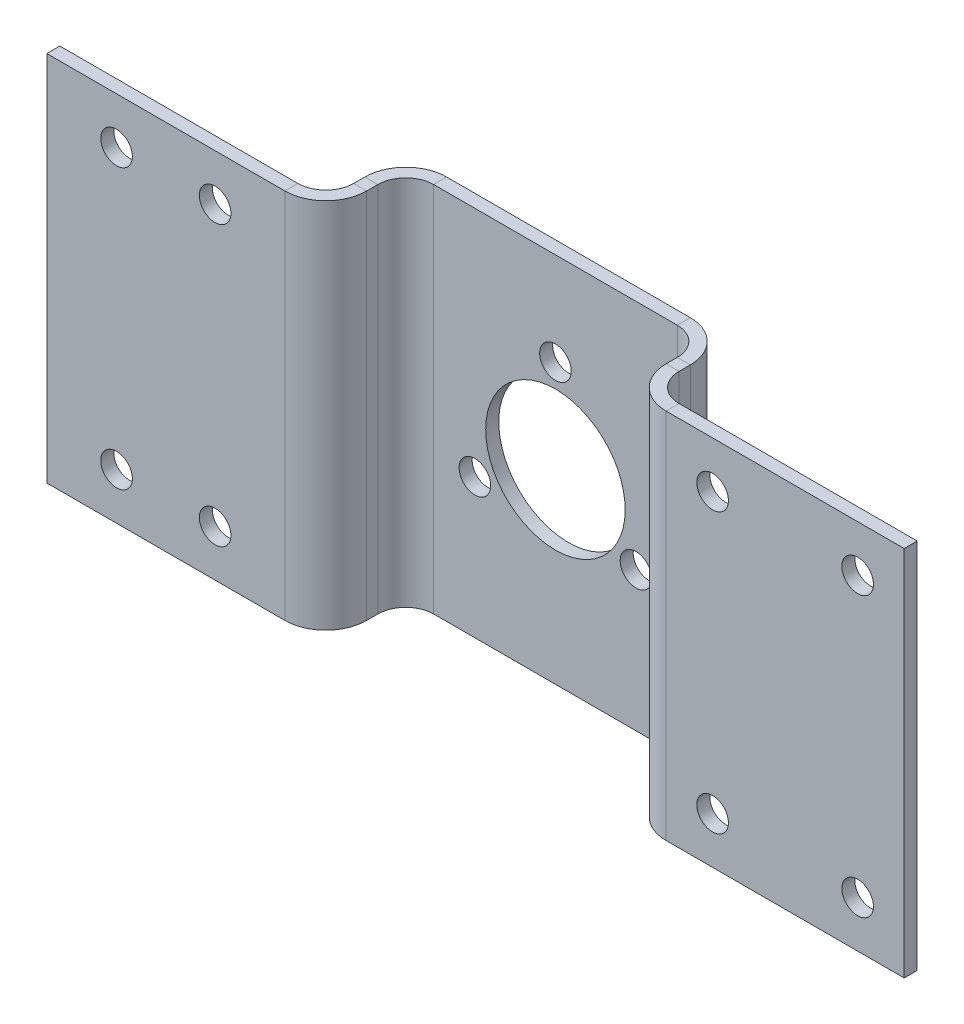
from build123d import *

# Parameters (mm, degrees)
SKETCH6_W                    = 35
SKETCH6_H                    = 40
BASE_FLANGE2_DEPTH           = 1.4
EDGE_FLANGE1_STRIP_W         = 11.6
EDGE_FLANGE1_STRIP_H         = 1.4
EDGE_FLANGE1_STRIP_CUT_DEPTH = 40
EDGE_FLANGE1_DEPTH           = 40
EDGE_FLANGE2_STRIP_W         = 11.6
EDGE_FLANGE2_STRIP_H         = 1.4
EDGE_FLANGE2_STRIP_CUT_DEPTH = 40
EDGE_FLANGE2_DEPTH           = 40
EDGE_FLANGE3_STRIP_W         = 11.6
EDGE_FLANGE3_STRIP_H         = 1.4
EDGE_FLANGE3_STRIP_CUT_DEPTH = 40
EDGE_FLANGE3_DEPTH           = 40
EDGE_FLANGE4_STRIP_W         = 11.6
EDGE_FLANGE4_STRIP_H         = 1.4
EDGE_FLANGE4_STRIP_CUT_DEPTH = 40
EDGE_FLANGE4_DEPTH           = 40
CUT_EXTRUDE2_DEPTH           = 76.623541308
CUT_EXTRUDE2_DEPTH_BACK      = 76.623541308
SKETCH11_R                   = 7.5
SKETCH11_R_2                 = 1.7
CUT_EXTRUDE3_DEPTH           = 76.795514379
CUT_EXTRUDE3_DEPTH_BACK      = 76.795514379
SKETCH26_R                   = 1.7
CUT_EXTRUDE4_DEPTH           = 76.795514379
CUT_EXTRUDE4_DEPTH_BACK      = 76.795514379
SKETCH27_R                   = 1.7


# Sheet-metal steps are written as plain solids
with BuildPart() as part:
    # Sketch6 → Base-Flange2 (new body)
    with BuildSketch(Plane.XY):
        with Locations((17.5, 20)):
            Rectangle(SKETCH6_W, SKETCH6_H)
    extrude(amount=-BASE_FLANGE2_DEPTH)

    # Edge-Flange1 strip (across the edge) → Edge-Flange1 strip cut (cut)
    with BuildSketch(Plane.XZ.offset(-40)):
        with Locations((-1.4, -0.7)):
            Rectangle(EDGE_FLANGE1_STRIP_W, EDGE_FLANGE1_STRIP_H)
    extrude(amount=EDGE_FLANGE1_STRIP_CUT_DEPTH, mode=Mode.SUBTRACT)

    # Edge-Flange1 section (across the edge) → Edge-Flange1 (add)
    with BuildSketch(Plane.XZ.offset(-40)):
        with BuildLine():
            Line((0, 3), (0, 8.6))
            Line((0, 8.6), (1.4, 8.6))
            Line((1.4, 8.6), (1.4, 3))
            ThreePointArc((1.4, 3), (2.278679656, 0.878679656), (4.4, 0))
            Line((4.4, 0), (4.4, -1.4))
            ThreePointArc((4.4, -1.4), (1.288730163, -0.111269837), (0, 3))
        make_face()
    extrude(amount=EDGE_FLANGE1_DEPTH)

    # Edge-Flange2 strip (across the edge) → Edge-Flange2 strip cut (cut)
    with BuildSketch(Plane(origin=(35, 0, 0), x_dir=(-1, 0, 0), z_dir=(0, 1, 0))):
        with Locations((-1.4, -0.7)):
            Rectangle(EDGE_FLANGE2_STRIP_W, EDGE_FLANGE2_STRIP_H)
    extrude(amount=EDGE_FLANGE2_STRIP_CUT_DEPTH, mode=Mode.SUBTRACT)

    # Edge-Flange2 section (across the edge) → Edge-Flange2 (add)
    with BuildSketch(Plane(origin=(35, 0, 0), x_dir=(-1, 0, 0), z_dir=(0, 1, 0))):
        with BuildLine():
            Line((0, 3), (0, 8.6))
            Line((0, 8.6), (1.4, 8.6))
            Line((1.4, 8.6), (1.4, 3))
            ThreePointArc((1.4, 3), (2.278679656, 0.878679656), (4.4, 0))
            Line((4.4, 0), (4.4, -1.4))
            ThreePointArc((4.4, -1.4), (1.288730163, -0.111269837), (0, 3))
        make_face()
    extrude(amount=EDGE_FLANGE2_DEPTH)

    # Edge-Flange3 strip (across the edge) → Edge-Flange3 strip cut (cut)
    with BuildSketch(Plane(origin=(0, 0, 8.6), x_dir=(0, 0, -1), z_dir=(0, 1, 0))):
        with Locations((-1.4, -0.7)):
            Rectangle(EDGE_FLANGE3_STRIP_W, EDGE_FLANGE3_STRIP_H)
    extrude(amount=EDGE_FLANGE3_STRIP_CUT_DEPTH, mode=Mode.SUBTRACT)

    # Edge-Flange3 section (across the edge) → Edge-Flange3 (add)
    with BuildSketch(Plane(origin=(0, 0, 8.6), x_dir=(0, 0, -1), z_dir=(0, 1, 0))):
        with BuildLine():
            Line((0, 3), (0, 28.6))
            Line((0, 28.6), (1.4, 28.6))
            Line((1.4, 28.6), (1.4, 3))
            ThreePointArc((1.4, 3), (2.278679656, 0.878679656), (4.4, 0))
            Line((4.4, 0), (4.4, -1.4))
            ThreePointArc((4.4, -1.4), (1.288730163, -0.111269837), (0, 3))
        make_face()
    extrude(amount=EDGE_FLANGE3_DEPTH)

    # Edge-Flange4 strip (across the edge) → Edge-Flange4 strip cut (cut)
    with BuildSketch(Plane(origin=(35, 40, 8.6), x_dir=(0, 0, -1), z_dir=(0, -1, 0))):
        with Locations((-1.4, -0.7)):
            Rectangle(EDGE_FLANGE4_STRIP_W, EDGE_FLANGE4_STRIP_H)
    extrude(amount=EDGE_FLANGE4_STRIP_CUT_DEPTH, mode=Mode.SUBTRACT)

    # Edge-Flange4 section (across the edge) → Edge-Flange4 (add)
    with BuildSketch(Plane(origin=(35, 40, 8.6), x_dir=(0, 0, -1), z_dir=(0, -1, 0))):
        with BuildLine():
            Line((0, 3), (0, 28.6))
            Line((0, 28.6), (1.4, 28.6))
            Line((1.4, 28.6), (1.4, 3))
            ThreePointArc((1.4, 3), (2.278679656, 0.878679656), (4.4, 0))
            Line((4.4, 0), (4.4, -1.4))
            ThreePointArc((4.4, -1.4), (1.288730163, -0.111269837), (0, 3))
        make_face()
    extrude(amount=EDGE_FLANGE4_DEPTH)

    # Sketch11 → Cut-Extrude2 (cut, two sides: drawn at the far end of the back side and taken through both)
    with BuildSketch(Plane.XY.offset(-CUT_EXTRUDE2_DEPTH_BACK)):
        with Locations((17.5, 20)):
            Circle(SKETCH11_R)
        with Locations((17.5, 30)):
            Circle(SKETCH11_R_2)
        with Locations((8.839745962, 15)):
            Circle(SKETCH11_R_2)
        with Locations((26.160254038, 15)):
            Circle(SKETCH11_R_2)
    extrude(amount=CUT_EXTRUDE2_DEPTH + CUT_EXTRUDE2_DEPTH_BACK, mode=Mode.SUBTRACT)

    # Sketch26 → Cut-Extrude3 (cut, two sides: drawn at the far end of the back side and taken through both)
    with BuildSketch(Plane.XY.offset(8.6).offset(-CUT_EXTRUDE3_DEPTH_BACK)):
        with Locations(Location((-21.1, 35, 0), (0, 0, 180))):
            Circle(SKETCH26_R)
        with Locations(Location((-10.5, 35, 0), (0, 0, 180))):
            Circle(SKETCH26_R)
        with Locations(Location((-21.1, 5, 0), (0, 0, 180))):
            Circle(SKETCH26_R)
        with Locations(Location((-10.5, 5, 0), (0, 0, 180))):
            Circle(SKETCH26_R)
    extrude(amount=CUT_EXTRUDE3_DEPTH + CUT_EXTRUDE3_DEPTH_BACK, mode=Mode.SUBTRACT)

    # Sketch27 → Cut-Extrude4 (cut, two sides: drawn at the far end of the back side and taken through both)
    with BuildSketch(Plane.XY.offset(8.6).offset(-CUT_EXTRUDE4_DEPTH_BACK)):
        with Locations(Location((43, 35, 0), (0, 0, 180))):
            Circle(SKETCH27_R)
        with Locations(Location((58.6, 35, 0), (0, 0, 180))):
            Circle(SKETCH27_R)
        with Locations(Location((43, 5, 0), (0, 0, 180))):
            Circle(SKETCH27_R)
        with Locations(Location((58.6, 5, 0), (0, 0, 180))):
            Circle(SKETCH27_R)
    extrude(amount=CUT_EXTRUDE4_DEPTH + CUT_EXTRUDE4_DEPTH_BACK, mode=Mode.SUBTRACT)


solid = part.part
